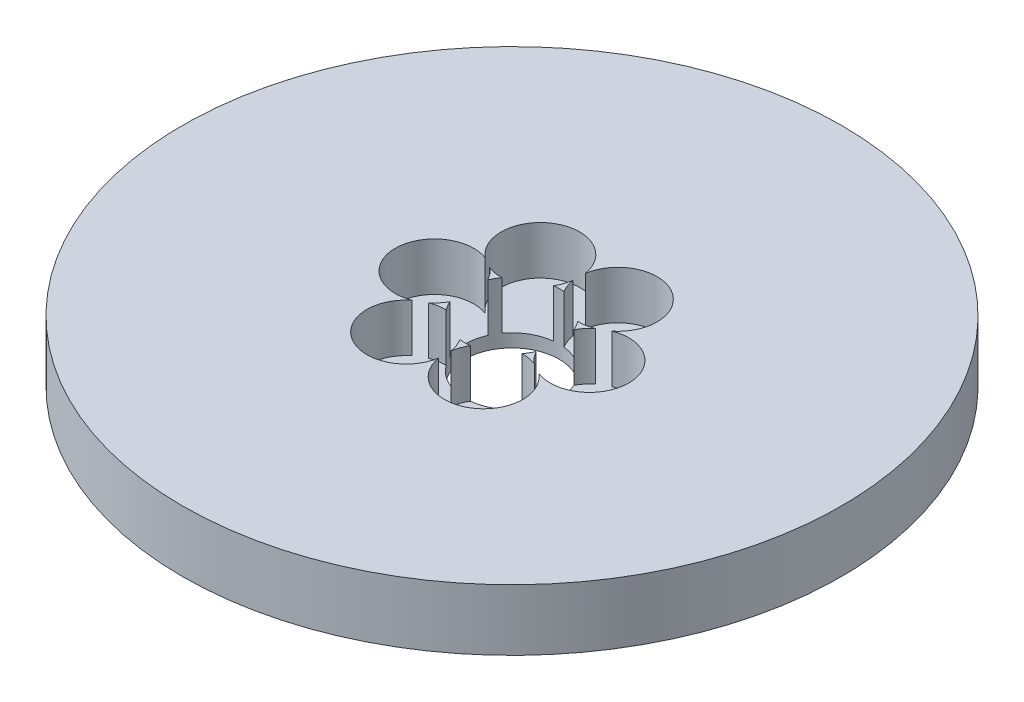
from build123d import *

# Parameters (mm, degrees)
SKETCH1_R           = 70
BOSS_EXTRUDE1_DEPTH = 13
SKETCH2_R           = 10
CUT_EXTRUDE1_DEPTH  = 100.844879688
SKETCH3_R           = 8.334076576
CUT_EXTRUDE2_DEPTH  = 10.220804832
CIRPATTERN1_COUNT   = 6


with BuildPart() as part:
    # Sketch1 → Boss-Extrude1 (new body)
    with BuildSketch(Plane(origin=(0, 0, 0), x_dir=(1, 0, 0), z_dir=(0, 1, 0))):
        Circle(SKETCH1_R)
    extrude(amount=BOSS_EXTRUDE1_DEPTH)

    # Sketch2 → Cut-Extrude1 (cut, through all)
    with BuildSketch(Plane(origin=(0, 0, 0), x_dir=(1, 0, 0), z_dir=(0, 1, 0))):
        Circle(SKETCH2_R)
    extrude(amount=CUT_EXTRUDE1_DEPTH, mode=Mode.SUBTRACT)

    # Sketch3 → Cut-Extrude2 (cut)
    with BuildSketch(Plane(origin=(0, 13, 0), x_dir=(1, 0, 0), z_dir=(0, 1, 0))):
        with Locations((-16.463436294, 0)):
            Circle(SKETCH3_R)
    cut_extrude2 = extrude(amount=-CUT_EXTRUDE2_DEPTH, mode=Mode.SUBTRACT)

    # CirPattern1: Cut-Extrude2 ×6 about axis
    cirpattern1_axis = Axis((0, 0, 0), (0, 1, 0))
    for i in range(1, CIRPATTERN1_COUNT):
        add(cut_extrude2.rotate(cirpattern1_axis, i * 360 / CIRPATTERN1_COUNT), mode=Mode.SUBTRACT)


solid = part.part
